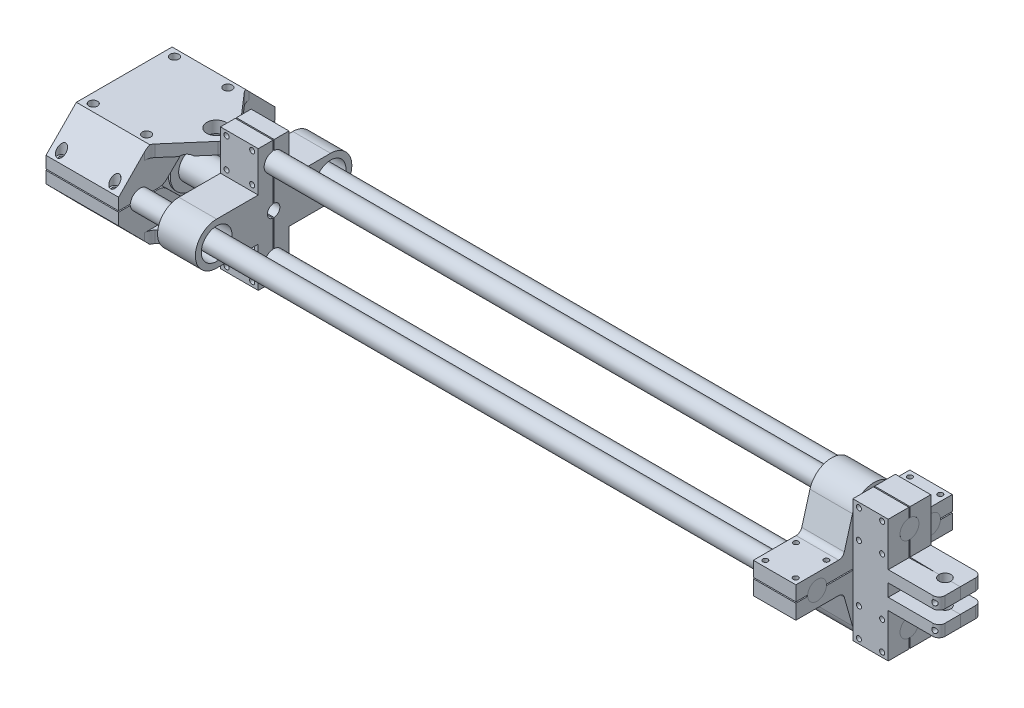
from build123d import *

# Parameters (mm, degrees)
SKETCH2_W              = 56.5
SKETCH2_H              = 56.5
SKETCH2_R              = 19.05
SKETCH2_R_2            = 2.5
SKETCH2_R_3            = 3.175
BOSS_EXTRUDE1_DEPTH    = 56.5
SKETCH2_5_R            = 19.05
SKETCH2_5_R_2          = 3.175
BOSS_EXTRUDE3_DEPTH    = 1.6
SKETCH2_6_R            = 3.175
BOSS_EXTRUDE4_DEPTH    = 20.6
BOSS_EXTRUDE2_START    = -56.5
SKETCH2_3_R            = 8
BOSS_EXTRUDE2_DEPTH    = 635
BOSS_EXTRUDE2_2_DEPTH  = 635
SKETCH3_R              = 12
SKETCH3_R_2            = 5
BOSS_EXTRUDE5_DEPTH    = 35
SKETCH3_3_R            = 5
SKETCH3_3_R_2          = 3.175
BOSS_EXTRUDE6_DEPTH    = 17
BOSS_EXTRUDE7_DEPTH    = 56.5
BOSS_EXTRUDE8_START    = -61.5
SKETCH4_4_R            = 2.5
BOSS_EXTRUDE8_DEPTH    = 5
SKETCH5_R              = 2.15
CUT_EXTRUDE1_DEPTH     = 584.425353328
FILLET1_START          = -57
FILLET1_DEPTH          = 62
FILLET1_2_DEPTH        = 5
SKETCH9_R              = 8.1
BOSS_EXTRUDE9_DEPTH    = 10
FILLET3_R              = 10
SKETCH10_R             = 4.5
CUT_EXTRUDE5_DEPTH     = 579.467927299
CUT_EXTRUDE2_START     = 10
SKETCH5_3_R            = 3.65
CUT_EXTRUDE2_DEPTH     = 574.425353335
CUT_EXTRUDE3_START     = 10
CUT_EXTRUDE3_DEPTH     = 574.425353335
SKETCH7_W              = 8
SKETCH7_H              = 10
CUT_EXTRUDE4_DEPTH     = 587.849938576
FILLET2_R              = 3
SKETCH12_R             = 13
BOSS_EXTRUDE10_DEPTH   = 36
SKETCH13_R             = 2.15
CUT_EXTRUDE6_DEPTH     = 585.38381472
FILLET4_R              = 5
SKETCH15_R             = 13
BOSS_EXTRUDE12_DEPTH   = 32
CUT_EXTRUDE8_START     = 11.9
CUT_EXTRUDE8_DEPTH     = 8.2
SKETCH16_R             = 2.15
CUT_EXTRUDE7_DEPTH     = 587.487691687
SKETCH17_R             = 8
BOSS_EXTRUDE13_DEPTH   = 570.5
BOSS_EXTRUDE13_2_DEPTH = 570.5
BOSS_EXTRUDE14_START   = -30
BOSS_EXTRUDE14_DEPTH   = 30
SKETCH20_R             = 2.15
CUT_EXTRUDE9_DEPTH     = 617.761957728
BOSS_EXTRUDE17_DEPTH   = 15
CUT_EXTRUDE10_DEPTH    = 5.3
SKETCH24_R             = 2.15
CUT_EXTRUDE11_DEPTH    = 660.223264532
FILLET5_R              = 5.08
FILLET6_R              = 5.08
FILLET7_R              = 5.08
FILLET8_R              = 5.08


with BuildPart() as part:
    # Sketch2 → Boss-Extrude1 (new body)
    # profile 1 of 3: a face of its own
    with BuildSketch(Plane(origin=(0, 0, 0), x_dir=(0, 0, -1), z_dir=(1, 0, 0))):
        Rectangle(SKETCH2_W, SKETCH2_H)
        Circle(SKETCH2_R, mode=Mode.SUBTRACT)
        with Locations((23.57, -23.57)):
            Circle(SKETCH2_R_2, mode=Mode.SUBTRACT)
        with Locations((-23.57, -23.57)):
            Circle(SKETCH2_R_2, mode=Mode.SUBTRACT)
        with Locations((-23.57, 23.57)):
            Circle(SKETCH2_R_2, mode=Mode.SUBTRACT)
        with Locations((23.57, 23.57)):
            Circle(SKETCH2_R_2, mode=Mode.SUBTRACT)
    # profile 2 of 3: a face of its own
    with BuildSketch(Plane(origin=(0, 0, 0), x_dir=(0, 0, -1), z_dir=(1, 0, 0))):
        Circle(SKETCH2_R)
        Circle(SKETCH2_R_3, mode=Mode.SUBTRACT)
    # profile 3 of 3: a face of its own
    with BuildSketch(Plane(origin=(0, 0, 0), x_dir=(0, 0, -1), z_dir=(1, 0, 0))):
        Circle(SKETCH2_R_3)
    extrude(amount=-BOSS_EXTRUDE1_DEPTH)

    # Sketch2<5> → Boss-Extrude3 (add)
    # profile 1 of 2: a face of its own
    with BuildSketch(Plane(origin=(0, 0, 0), x_dir=(0, 0, -1), z_dir=(1, 0, 0))):
        Circle(SKETCH2_5_R)
        Circle(SKETCH2_5_R_2, mode=Mode.SUBTRACT)
    # profile 2 of 2: a face of its own
    with BuildSketch(Plane(origin=(0, 0, 0), x_dir=(0, 0, -1), z_dir=(1, 0, 0))):
        Circle(SKETCH2_5_R_2)
    extrude(amount=BOSS_EXTRUDE3_DEPTH)

    # Sketch2<6> → Boss-Extrude4 (add)
    with BuildSketch(Plane(origin=(0, 0, 0), x_dir=(0, 0, -1), z_dir=(1, 0, 0))):
        with Locations(Location((0, 0, 0), (0, 0, 180))):
            Circle(SKETCH2_6_R)
    extrude(amount=BOSS_EXTRUDE4_DEPTH)


with BuildPart() as body_2:
    # Sketch2<3> → Boss-Extrude2 (new body)
    with BuildSketch(Plane(origin=(0, 0, 0), x_dir=(0, 0, -1), z_dir=(1, 0, 0)).offset(BOSS_EXTRUDE2_START)):
        with Locations(Location((48.25, 0, 0), (0, 0, 180))):
            Circle(SKETCH2_3_R)
    extrude(amount=BOSS_EXTRUDE2_DEPTH)


with BuildPart() as body_3:
    # Sketch2<3> → Boss-Extrude2 2 (new body)
    with BuildSketch(Plane(origin=(0, 0, 0), x_dir=(0, 0, -1), z_dir=(1, 0, 0)).offset(BOSS_EXTRUDE2_START)):
        with Locations(Location((-48.25, 0, 0), (0, 0, 180))):
            Circle(SKETCH2_3_R)
    extrude(amount=BOSS_EXTRUDE2_2_DEPTH)


with BuildPart() as body_4:
    # Sketch3 → Boss-Extrude5 (new body)
    with BuildSketch(Plane(origin=(1.6, 0, 0), x_dir=(0, 0, -1), z_dir=(1, 0, 0))):
        Circle(SKETCH3_R)
        Circle(SKETCH3_R_2, mode=Mode.SUBTRACT)
    extrude(amount=BOSS_EXTRUDE5_DEPTH)

    # Sketch3<3> → Boss-Extrude6 (add)
    with BuildSketch(Plane(origin=(1.6, 0, 0), x_dir=(0, 0, -1), z_dir=(1, 0, 0))):
        Circle(SKETCH3_3_R)
        Circle(SKETCH3_3_R_2, mode=Mode.SUBTRACT)
    extrude(amount=BOSS_EXTRUDE6_DEPTH)


with BuildPart() as body_5:
    # Sketch4 → Boss-Extrude7 (new body)
    with BuildSketch(Plane.ZY.offset(56.5)):
        with BuildLine():
            Line((-66.234359711, 0.5), (-56.234359711, 0.5))
            ThreePointArc((-56.234359711, 0.5), (-48.25, 8), (-40.265640289, 0.5))
            Line((-40.265640289, 0.5), (-28.55, 0.5))
            Line((-28.55, 0.5), (-28.55, 28.55))
            Line((-28.55, 28.55), (28.55, 28.55))
            Line((28.55, 28.55), (28.55, 0.5))
            Line((28.55, 0.5), (40.265640289, 0.5))
            ThreePointArc((40.265640289, 0.5), (48.25, 8), (56.234359711, 0.5))
            Line((56.234359711, 0.5), (66.234359711, 0.5))
            Line((66.234359711, 0.5), (66.234359711, 10.5))
            Line((66.234359711, 10.5), (40.55, 36.55))
            Line((40.55, 36.55), (-40.55, 36.55))
            Line((-40.55, 36.55), (-66.234359711, 10.5))
            Line((-66.234359711, 10.5), (-66.234359711, 0.5))
        make_face()
    extrude(amount=-BOSS_EXTRUDE7_DEPTH)

    # Sketch4<4> → Boss-Extrude8 (add)
    with BuildSketch(Plane.ZY.offset(56.5).offset(BOSS_EXTRUDE8_START)):
        with BuildLine():
            Line((-66.234359711, 10.5), (-66.234359711, 0.5))
            Line((-66.234359711, 0.5), (-56.234359711, 0.5))
            ThreePointArc((-56.234359711, 0.5), (-48.25, 8), (-40.265640289, 0.5))
            Line((-40.265640289, 0.5), (-28.55, 0.5))
            Line((-28.55, 0.5), (0, 28.55))
            Line((0, 28.55), (28.55, 0.5))
            Line((28.55, 0.5), (40.265640289, 0.5))
            ThreePointArc((40.265640289, 0.5), (48.25, 8), (56.234359711, 0.5))
            Line((56.234359711, 0.5), (66.234359711, 0.5))
            Line((66.234359711, 0.5), (66.234359711, 10.5))
            Line((66.234359711, 10.5), (40.55, 36.55))
            Line((40.55, 36.55), (-40.55, 36.55))
            Line((-40.55, 36.55), (-66.234359711, 10.5))
        make_face()
        with Locations(Location((-23.57, 23.57, 0), (0, 0, 180))):
            Circle(SKETCH4_4_R, mode=Mode.SUBTRACT)
        with Locations(Location((23.57, 23.57, 0), (0, 0, 180))):
            Circle(SKETCH4_4_R, mode=Mode.SUBTRACT)
    extrude(amount=BOSS_EXTRUDE8_DEPTH)

    # Sketch5 → Cut-Extrude1 (cut, through all)
    with BuildSketch(Plane(origin=(0, 0, 0), x_dir=(1, 0, 0), z_dir=(0, 1, 0))):
        with Locations(Location((-48.35, 61.234359711, 0), (0, 0, 90))):
            Circle(SKETCH5_R)
        with Locations(Location((-3.15, 61.234359711, 0), (0, 0, 90))):
            Circle(SKETCH5_R)
        with Locations(Location((-48.35, 34.407820144, 0), (0, 0, 270))):
            Circle(SKETCH5_R)
        with Locations(Location((-3.15, 34.407820144, 0), (0, 0, 270))):
            Circle(SKETCH5_R)
    cut_extrude1 = extrude(amount=CUT_EXTRUDE1_DEPTH, mode=Mode.SUBTRACT)

    # Fillet1: read off the stored shape, not the designer's step
    # Fillet1 outline → Fillet1 (cut)
    with BuildSketch(Plane.YZ.offset(FILLET1_START)):
        with BuildLine():
            Line((0.5, 28.55), (3.366745252, 25.632154119))
            ThreePointArc((3.366745252, 25.632154119), (1.244392309, 28.854492424), (0.5, 32.640483214))
            Line((0.5, 32.640483214), (0.5, 28.55))
        make_face()
        with BuildLine():
            ThreePointArc((0.5, -32.640483214), (1.244392309, -28.854492424), (3.366745252, -25.632154119))
            Line((3.366745252, -25.632154119), (0.5, -28.55))
            Line((0.5, -28.55), (0.5, -32.640483214))
        make_face()
    extrude(amount=FILLET1_DEPTH, mode=Mode.SUBTRACT)

    # Fillet1 2 outline → Fillet1 2 (add)
    with BuildSketch(Plane.YZ):
        with BuildLine():
            Line((28.55, 0), (21.664408717, 7.008329095))
            ThreePointArc((21.664408717, 7.008329095), (24.53115397, 0), (21.664408717, -7.008329095))
            Line((21.664408717, -7.008329095), (28.55, 0))
        make_face()
    extrude(amount=FILLET1_2_DEPTH)

    # Mirror3: Cut-Extrude1 across plane
    add(cut_extrude1.mirror(Plane.XY), mode=Mode.SUBTRACT)

    # Sketch9 → Boss-Extrude9 (add)
    with BuildSketch(Plane(origin=(0, 36.55, 0), x_dir=(1, 0, 0), z_dir=(0, 1, 0))):
        with BuildLine():
            Line((5, 40.55), (32.152667604, 9.237460307))
            ThreePointArc((32.152667604, 9.237460307), (35.6, 0), (32.152667604, -9.237460307))
            Line((32.152667604, -9.237460307), (5, -40.55))
            Line((5, -40.55), (5, 40.55))
        make_face()
        with Locations(Location((21.5, 0, 0), (0, 0, 270))):
            Circle(SKETCH9_R, mode=Mode.SUBTRACT)
    extrude(amount=-BOSS_EXTRUDE9_DEPTH)

    # Fillet3
    fillet3_edges = [body_5.edges().sort_by_distance(p)[0] for p in [
        (5, 31.55, 40.55),
        (5, 31.55, -40.55),
    ]]
    fillet(fillet3_edges, radius=FILLET3_R)

    # Sketch10 → Cut-Extrude5 (cut, through all)
    with BuildSketch(Plane(origin=(5, 0, 0), x_dir=(0, 0, -1), z_dir=(1, 0, 0))):
        with Locations((-23.57, 23.57)):
            Circle(SKETCH10_R)
        with Locations((23.57, 23.57)):
            Circle(SKETCH10_R)
    extrude(amount=CUT_EXTRUDE5_DEPTH, mode=Mode.SUBTRACT)


with BuildPart() as body_6:
    # Mirror2: mirrored copy
    add(body_5.part.mirror(Plane.ZX))

    # Sketch6 → Cut-Extrude3 (cut, through all)
    with BuildSketch(Plane.XZ.offset(CUT_EXTRUDE3_START)):
        Polygon((-44.164210548, -34.407820144), (-46.257105274, -30.782820144), (-50.442894726, -30.782820144), (-52.535789452, -34.407820144), (-50.442894726, -38.032820144), (-46.257105274, -38.032820144), align=None)
        Polygon((1.035789452, -34.407820144), (-1.057105274, -30.782820144), (-5.242894726, -30.782820144), (-7.335789452, -34.407820144), (-5.242894726, -38.032820144), (-1.057105274, -38.032820144), align=None)
        Polygon((-44.164210548, -61.234359711), (-46.257105274, -57.609359711), (-50.442894726, -57.609359711), (-52.535789452, -61.234359711), (-50.442894726, -64.859359711), (-46.257105274, -64.859359711), align=None)
        Polygon((1.035789452, -61.234359711), (-1.057105274, -57.609359711), (-5.242894726, -57.609359711), (-7.335789452, -61.234359711), (-5.242894726, -64.859359711), (-1.057105274, -64.859359711), align=None)
    cut_extrude3 = extrude(amount=CUT_EXTRUDE3_DEPTH, mode=Mode.SUBTRACT)


with BuildPart() as body_5_1:
    add(body_5.part)

    # Sketch5<3> → Cut-Extrude2 (cut, through all)
    with BuildSketch(Plane(origin=(0, 0, 0), x_dir=(1, 0, 0), z_dir=(0, 1, 0)).offset(CUT_EXTRUDE2_START)):
        with Locations(Location((-3.15, 61.234359711, 0), (0, 0, 90))):
            Circle(SKETCH5_3_R)
        with Locations(Location((-48.35, 61.234359711, 0), (0, 0, 90))):
            Circle(SKETCH5_3_R)
        with Locations(Location((-48.35, 34.407820144, 0), (0, 0, 270))):
            Circle(SKETCH5_3_R)
        with Locations(Location((-3.15, 34.407820144, 0), (0, 0, 270))):
            Circle(SKETCH5_3_R)
    cut_extrude2 = extrude(amount=CUT_EXTRUDE2_DEPTH, mode=Mode.SUBTRACT)


with BuildPart() as mirror1_tool:
    # Mirror1: Cut-Extrude2, Cut-Extrude3 across plane
    add(cut_extrude2.mirror(Plane.XY))
    add(cut_extrude3.mirror(Plane.XY))


with BuildPart() as body_5_2:
    add(body_5_1.part)

    # Mirror1: cut by mirror1_tool
    add(mirror1_tool.part, mode=Mode.SUBTRACT)


with BuildPart() as body_6_1:
    add(body_6.part)

    # Mirror1: cut by mirror1_tool
    add(mirror1_tool.part, mode=Mode.SUBTRACT)

    # Sketch7 → Cut-Extrude4 (cut, through all)
    with BuildSketch(Plane.XZ.offset(36.55)):
        with Locations((-52.5, 0)):
            Rectangle(SKETCH7_W, SKETCH7_H)
    extrude(amount=-CUT_EXTRUDE4_DEPTH, mode=Mode.SUBTRACT)

    # Fillet2
    fillet2_edges = [body_6_1.edges().sort_by_distance(p)[0] for p in [
        (-56.5, -32.55, -5),
        (-56.5, -32.55, 5),
        (-48.5, -32.55, 5),
        (-48.5, -32.55, -5),
    ]]
    fillet(fillet2_edges, radius=FILLET2_R)


with BuildPart() as body_7:
    # Sketch12 → Boss-Extrude10 (new body)
    with BuildSketch(Plane(origin=(578.5, 0, 0), x_dir=(0, 0, -1), z_dir=(1, 0, 0))):
        with BuildLine():
            Line((-56.234359711, 0.5), (-66.234359711, 0.5))
            Line((-66.234359711, 0.5), (-66.234359711, 13))
            Line((-66.234359711, 13), (-26.234359711, 13))
            Line((-26.234359711, 13), (-18.285544518, 41.161284887))
            ThreePointArc((-18.285544518, 41.161284887), (0, 55), (18.285544518, 41.161284887))
            Line((18.285544518, 41.161284887), (26.234359711, 13))
            Line((26.234359711, 13), (66.234359711, 13))
            Line((66.234359711, 13), (66.234359711, 0.5))
            Line((66.234359711, 0.5), (56.234359711, 0.5))
            ThreePointArc((56.234359711, 0.5), (48.25, 8), (40.265640289, 0.5))
            Line((40.265640289, 0.5), (-40.265640289, 0.5))
            ThreePointArc((-40.265640289, 0.5), (-48.25, 8), (-56.234359711, 0.5))
        make_face()
        with Locations((0, 36)):
            Circle(SKETCH12_R, mode=Mode.SUBTRACT)
    extrude(amount=-BOSS_EXTRUDE10_DEPTH)

    # Sketch13 → Cut-Extrude6 (cut, through all)
    with BuildSketch(Plane(origin=(0, 13, 0), x_dir=(1, 0, 0), z_dir=(0, 1, 0))):
        with Locations(Location((547.65, 61.234359711, 0), (0, 0, 270))):
            Circle(SKETCH13_R)
        with Locations(Location((573.35, 61.234359711, 0), (0, 0, 270))):
            Circle(SKETCH13_R)
        with Locations(Location((547.65, 35.265640289, 0), (0, 0, 270))):
            Circle(SKETCH13_R)
        with Locations(Location((573.35, 35.265640289, 0), (0, 0, 270))):
            Circle(SKETCH13_R)
    cut_extrude6 = extrude(amount=-CUT_EXTRUDE6_DEPTH, mode=Mode.SUBTRACT)

    # Mirror5: Cut-Extrude6 across plane
    add(cut_extrude6.mirror(Plane.XY), mode=Mode.SUBTRACT)

    # Fillet4
    fillet4_edges = [body_7.edges().sort_by_distance(p)[0] for p in [
        (560.5, 13, -26.234359711),
        (560.5, 13, 26.234359711),
    ]]
    fillet(fillet4_edges, radius=FILLET4_R)


with BuildPart() as body_8:
    # Mirror4: mirrored copy
    add(body_7.part.mirror(Plane.ZX))


with BuildPart() as cut_revolve1_tool:
    # Sketch14 → Cut-Revolve1 (revolve)
    with BuildSketch(Plane(origin=(0, 0, 0), x_dir=(1, 0, 0), z_dir=(0, 1, 0))):
        Polygon((578.5, 0), (542.5, 0), (542.5, 5.3), (554.85, 5.3), (554.85, 12.2), (555.85, 12.2), (555.85, 15.2), (565.15, 15.2), (565.15, 12.2), (566.15, 12.2), (566.15, 5.3), (578.5, 5.3), align=None)
    revolve(axis=Axis((578.5, 0, 0), (-1, 0, 0)))


with BuildPart() as body_7_1:
    add(body_7.part)

    # Cut-Revolve1: cut by cut_revolve1_tool
    add(cut_revolve1_tool.part, mode=Mode.SUBTRACT)


with BuildPart() as body_8_1:
    add(body_8.part)

    # Cut-Revolve1: cut by cut_revolve1_tool
    add(cut_revolve1_tool.part, mode=Mode.SUBTRACT)


with BuildPart() as body_9:
    # Sketch15 → Boss-Extrude12 (new body)
    # profile 1 of 4: a face of its own
    with BuildSketch(Plane(origin=(38, 0, 0), x_dir=(0, 0, -1), z_dir=(1, 0, 0))):
        with BuildLine():
            Line((-13, 18), (-48.25, 18))
            ThreePointArc((-48.25, 18), (-66.25, 0), (-48.25, -18))
            Line((-48.25, -18), (-13, -18))
            Line((-13, -18), (-13, -52))
            Line((-13, -52), (-0.5, -52))
            Line((-0.5, -52), (-0.5, -43.984359711))
            ThreePointArc((-0.5, -43.984359711), (-8, -36), (-0.5, -28.015640289))
            Line((-0.5, -28.015640289), (-0.5, -8.5))
            Line((-0.5, -8.5), (-4.907477288, -8.5))
            Line((-4.907477288, -8.5), (-9.814954576, 0))
            Line((-9.814954576, 0), (-4.907477288, 8.5))
            Line((-4.907477288, 8.5), (-0.5, 8.5))
            Line((-0.5, 8.5), (-0.5, 28.015640289))
            ThreePointArc((-0.5, 28.015640289), (-8, 36), (-0.5, 43.984359711))
            Line((-0.5, 43.984359711), (-0.5, 52))
            Line((-0.5, 52), (-13, 52))
            Line((-13, 52), (-13, 18))
        make_face()
        with Locations((-48.25, 0)):
            Circle(SKETCH15_R, mode=Mode.SUBTRACT)
    # profile 2 of 4: a face of its own
    with BuildSketch(Plane(origin=(38, 0, 0), x_dir=(0, 0, -1), z_dir=(1, 0, 0))):
        with BuildLine():
            Line((13, 52), (0.5, 52))
            Line((0.5, 52), (0.5, 43.984359711))
            ThreePointArc((0.5, 43.984359711), (5.830951895, 41.477225575), (8, 36))
            ThreePointArc((8, 36), (5.830951895, 30.522774425), (0.5, 28.015640289))
            Line((0.5, 28.015640289), (0.5, 8.5))
            Line((0.5, 8.5), (4.907477288, 8.5))
            Line((4.907477288, 8.5), (9.814954576, 0))
            Line((9.814954576, 0), (4.907477288, -8.5))
            Line((4.907477288, -8.5), (0.5, -8.5))
            Line((0.5, -8.5), (0.5, -28.015640289))
            ThreePointArc((0.5, -28.015640289), (5.830951895, -30.522774425), (8, -36))
            ThreePointArc((8, -36), (5.830951895, -41.477225575), (0.5, -43.984359711))
            Line((0.5, -43.984359711), (0.5, -52))
            Line((0.5, -52), (13, -52))
            Line((13, -52), (13, -18))
            Line((13, -18), (48.25, -18))
            ThreePointArc((48.25, -18), (66.25, 0), (48.25, 18))
            Line((48.25, 18), (13, 18))
            Line((13, 18), (13, 52))
        make_face()
        with Locations((48.25, 0)):
            Circle(SKETCH15_R, mode=Mode.SUBTRACT)
    # profile 3 of 4: a face of its own
    with BuildSketch(Plane(origin=(38, 0, 0), x_dir=(0, 0, -1), z_dir=(1, 0, 0))):
        with BuildLine():
            Line((4.907477288, 8.5), (0.5, 8.5))
            Line((0.5, 8.5), (0.5, 5.276362383))
            ThreePointArc((0.5, 5.276362383), (3.920459157, 3.5665109), (5.3, 0))
            ThreePointArc((5.3, 0), (3.920459157, -3.5665109), (0.5, -5.276362383))
            Line((0.5, -5.276362383), (0.5, -8.5))
            Line((0.5, -8.5), (4.907477288, -8.5))
            Line((4.907477288, -8.5), (9.814954576, 0))
            Line((9.814954576, 0), (4.907477288, 8.5))
        make_face()
    # profile 4 of 4: a face of its own
    with BuildSketch(Plane(origin=(38, 0, 0), x_dir=(0, 0, -1), z_dir=(1, 0, 0))):
        with BuildLine():
            Line((-0.5, 5.276362383), (-0.5, 8.5))
            Line((-0.5, 8.5), (-4.907477288, 8.5))
            Line((-4.907477288, 8.5), (-9.814954576, 0))
            Line((-9.814954576, 0), (-4.907477288, -8.5))
            Line((-4.907477288, -8.5), (-0.5, -8.5))
            Line((-0.5, -8.5), (-0.5, -5.276362383))
            ThreePointArc((-0.5, -5.276362383), (-5.3, 0), (-0.5, 5.276362383))
        make_face()
    extrude(amount=BOSS_EXTRUDE12_DEPTH)

    # Sketch15<3> → Cut-Extrude8 (cut)
    with BuildSketch(Plane(origin=(38, 0, 0), x_dir=(0, 0, -1), z_dir=(1, 0, 0)).offset(CUT_EXTRUDE8_START)):
        with BuildLine():
            Line((4.907477288, 8.5), (0.5, 8.5))
            Line((0.5, 8.5), (0.5, 5.276362383))
            ThreePointArc((0.5, 5.276362383), (3.920459157, 3.5665109), (5.3, 0))
            ThreePointArc((5.3, 0), (3.920459157, -3.5665109), (0.5, -5.276362383))
            Line((0.5, -5.276362383), (0.5, -8.5))
            Line((0.5, -8.5), (4.907477288, -8.5))
            Line((4.907477288, -8.5), (9.814954576, 0))
            Line((9.814954576, 0), (4.907477288, 8.5))
        make_face()
        with BuildLine():
            Line((-0.5, 5.276362383), (-0.5, 8.5))
            Line((-0.5, 8.5), (-4.907477288, 8.5))
            Line((-4.907477288, 8.5), (-9.814954576, 0))
            Line((-9.814954576, 0), (-4.907477288, -8.5))
            Line((-4.907477288, -8.5), (-0.5, -8.5))
            Line((-0.5, -8.5), (-0.5, -5.276362383))
            ThreePointArc((-0.5, -5.276362383), (-5.3, 0), (-0.5, 5.276362383))
        make_face()
    extrude(amount=CUT_EXTRUDE8_DEPTH, mode=Mode.SUBTRACT)

    # Sketch16 → Cut-Extrude7 (cut, through all)
    with BuildSketch(Plane.XY.offset(13)):
        with Locations((64.85, 47.992179856)):
            Circle(SKETCH16_R)
        with Locations((43.15, 47.992179856)):
            Circle(SKETCH16_R)
        with Locations((43.15, 23.007820144)):
            Circle(SKETCH16_R)
        with Locations((64.85, 23.007820144)):
            Circle(SKETCH16_R)
    cut_extrude7 = extrude(amount=-CUT_EXTRUDE7_DEPTH, mode=Mode.SUBTRACT)

    # Mirror6: Cut-Extrude7 across plane
    add(cut_extrude7.mirror(Plane.ZX), mode=Mode.SUBTRACT)


with BuildPart() as body_10:
    # Sketch17 → Boss-Extrude13 (new body)
    with BuildSketch(Plane.ZY.offset(-38)):
        with Locations((0, 36)):
            Circle(SKETCH17_R)
    extrude(amount=-BOSS_EXTRUDE13_DEPTH)


with BuildPart() as body_11:
    # Sketch17 → Boss-Extrude13 2 (new body)
    with BuildSketch(Plane.ZY.offset(-38)):
        with Locations((0, -36)):
            Circle(SKETCH17_R)
    extrude(amount=-BOSS_EXTRUDE13_2_DEPTH)


with BuildPart() as body_12:
    # Boss-Extrude14: read off the stored shape, not the designer's step
    # Boss-Extrude14 outline → Boss-Extrude14 (new body)
    with BuildSketch(Plane(origin=(608.5, 0, 0), x_dir=(0, 0, -1), z_dir=(1, 0, 0)).offset(BOSS_EXTRUDE14_START)):
        with BuildLine():
            ThreePointArc((0.5, -28.015640289), (8, -36), (0.5, -43.984359711))
            Line((0.5, -43.984359711), (0.5, -52))
            Line((0.5, -52), (18, -52))
            Line((18, -52), (18, 52))
            Line((18, 52), (0.5, 52))
            Line((0.5, 52), (0.5, 43.984359711))
            ThreePointArc((0.5, 43.984359711), (8, 36), (0.5, 28.015640289))
            Line((0.5, 28.015640289), (0.5, -28.015640289))
        make_face()
    extrude(amount=BOSS_EXTRUDE14_DEPTH)

    # Sketch20 → Cut-Extrude9 (cut, through all)
    with BuildSketch(Plane(origin=(0, 0, -18), x_dir=(-1, 0, 0), z_dir=(0, 0, -1))):
        with Locations((-603.35, 47.992179856)):
            Circle(SKETCH20_R)
        with Locations((-583.65, 47.992179856)):
            Circle(SKETCH20_R)
        with Locations((-603.35, 24.007820144)):
            Circle(SKETCH20_R)
        with Locations((-583.65, 24.007820144)):
            Circle(SKETCH20_R)
    cut_extrude9 = extrude(amount=-CUT_EXTRUDE9_DEPTH, mode=Mode.SUBTRACT)

    # Mirror7: Cut-Extrude9 across plane
    add(cut_extrude9.mirror(Plane.ZX), mode=Mode.SUBTRACT)

    # Sketch22 → Boss-Extrude17 (add, symmetric)
    with BuildSketch(Plane(origin=(0, 0, 0), x_dir=(1, 0, 0), z_dir=(0, 1, 0))):
        with BuildLine():
            Line((651.5, 0), (651.5, 18))
            Line((651.5, 18), (608.5, 18))
            Line((608.5, 18), (608.5, 0.5))
            Line((608.5, 0.5), (630.5, 0))
            Line((630.5, 0), (633.5, 0))
            ThreePointArc((633.5, 0), (638.5, 5), (643.5, 0))
            Line((643.5, 0), (651.5, 0))
        make_face()
    extrude(amount=BOSS_EXTRUDE17_DEPTH, both=True)

    # Sketch22<4> → Cut-Extrude10 (cut, symmetric)
    with BuildSketch(Plane(origin=(0, 0, 0), x_dir=(1, 0, 0), z_dir=(0, 1, 0))):
        with BuildLine():
            Line((651.5, 0), (651.5, 18))
            Line((651.5, 18), (608.5, 18))
            Line((608.5, 18), (608.5, 0.5))
            Line((608.5, 0.5), (630.5, 0))
            Line((630.5, 0), (633.5, 0))
            ThreePointArc((633.5, 0), (638.5, 5), (643.5, 0))
            Line((643.5, 0), (651.5, 0))
        make_face()
    extrude(amount=CUT_EXTRUDE10_DEPTH, both=True, mode=Mode.SUBTRACT)


with BuildPart() as body_13:
    # Mirror8: mirrored copy
    add(body_12.part.mirror(Plane.XY))


with BuildPart() as cut_extrude11_tool:
    # Sketch24 → Cut-Extrude11 (new, through all)
    with BuildSketch(Plane(origin=(0, 0, -18), x_dir=(-1, 0, 0), z_dir=(0, 0, -1))):
        with Locations((-647.5, 10.15)):
            Circle(SKETCH24_R)
        with Locations((-647.5, -10.15)):
            Circle(SKETCH24_R)
    extrude(amount=-CUT_EXTRUDE11_DEPTH)


with BuildPart() as body_12_1:
    add(body_12.part)

    # Cut-Extrude11: cut by cut_extrude11_tool
    add(cut_extrude11_tool.part, mode=Mode.SUBTRACT)

    # Fillet6
    # the kernel refuses this fillet: 5.08 mm, written as the material it takes off along each edge
    with BuildSketch(Plane(origin=(651.5, 5.3, -18), x_dir=(-1, 0, 0), z_dir=(0, 1, 0))) as fillet6_piece_1:
        with BuildLine():
            CenterArc((FILLET6_R, FILLET6_R), FILLET6_R, 180, 90)
            Line((0, FILLET6_R), (-FILLET6_R * 0.02, FILLET6_R))
            Line((-FILLET6_R * 0.02, FILLET6_R), (-FILLET6_R * 0.02, -FILLET6_R * 0.02))
            Line((-FILLET6_R * 0.02, -FILLET6_R * 0.02), (FILLET6_R, -FILLET6_R * 0.02))
            Line((FILLET6_R, -FILLET6_R * 0.02), (FILLET6_R, 0))
        make_face()
    extrude(amount=9.7, mode=Mode.SUBTRACT)

    # Fillet8
    # the kernel refuses this fillet: 5.08 mm, written as the material it takes off along each edge
    with BuildSketch(Plane(origin=(651.5, -27.7, -18), x_dir=(-1, 0, 0), z_dir=(0, 1, 0))) as fillet8_piece_1:
        with BuildLine():
            CenterArc((FILLET8_R, FILLET8_R), FILLET8_R, 180, 90)
            Line((0, FILLET8_R), (0, 0))
            Line((0, 0), (FILLET8_R, 0))
        make_face()
    extrude(amount=35.1, mode=Mode.SUBTRACT)


with BuildPart() as body_13_1:
    add(body_13.part)

    # Cut-Extrude11: cut by cut_extrude11_tool
    add(cut_extrude11_tool.part, mode=Mode.SUBTRACT)

    # Fillet5
    # the kernel refuses this fillet: 5.08 mm, written as the material it takes off along each edge
    with BuildSketch(Plane(origin=(651.5, -7.4, 18), x_dir=(-1, 0, 0), z_dir=(0, 1, 0))) as fillet5_piece_1_section:
        with BuildLine():
            CenterArc((FILLET5_R, -FILLET5_R), FILLET5_R, 90, 90)
            Line((0, -FILLET5_R), (0, 0))
            Line((0, 0), (FILLET5_R, 0))
        make_face()
    fillet5_piece_1 = extrude(amount=35.1, mode=Mode.PRIVATE)
    fillet5_piece_1 = split(fillet5_piece_1, bisect_by=Plane(origin=(651.5, -5.3, 18), z_dir=(0, 1, 0)), keep=Keep.TOP, mode=Mode.PRIVATE)
    add(fillet5_piece_1, mode=Mode.SUBTRACT)

    # Fillet7
    # the kernel refuses this fillet: 5.08 mm, written as the material it takes off along each edge
    with BuildSketch(Plane(origin=(651.5, -27.7, 18), x_dir=(-1, 0, 0), z_dir=(0, 1, 0))) as fillet7_piece_1:
        with BuildLine():
            CenterArc((FILLET7_R, -FILLET7_R), FILLET7_R, 90, 90)
            Line((0, -FILLET7_R), (0, 0))
            Line((0, 0), (FILLET7_R, 0))
        make_face()
    extrude(amount=35.1, mode=Mode.SUBTRACT)


solid = Compound([part.part, body_2.part, body_3.part, body_4.part, body_5_2.part, body_6_1.part, body_7_1.part, body_8_1.part, body_9.part, body_10.part, body_11.part, body_12_1.part, body_13_1.part])
